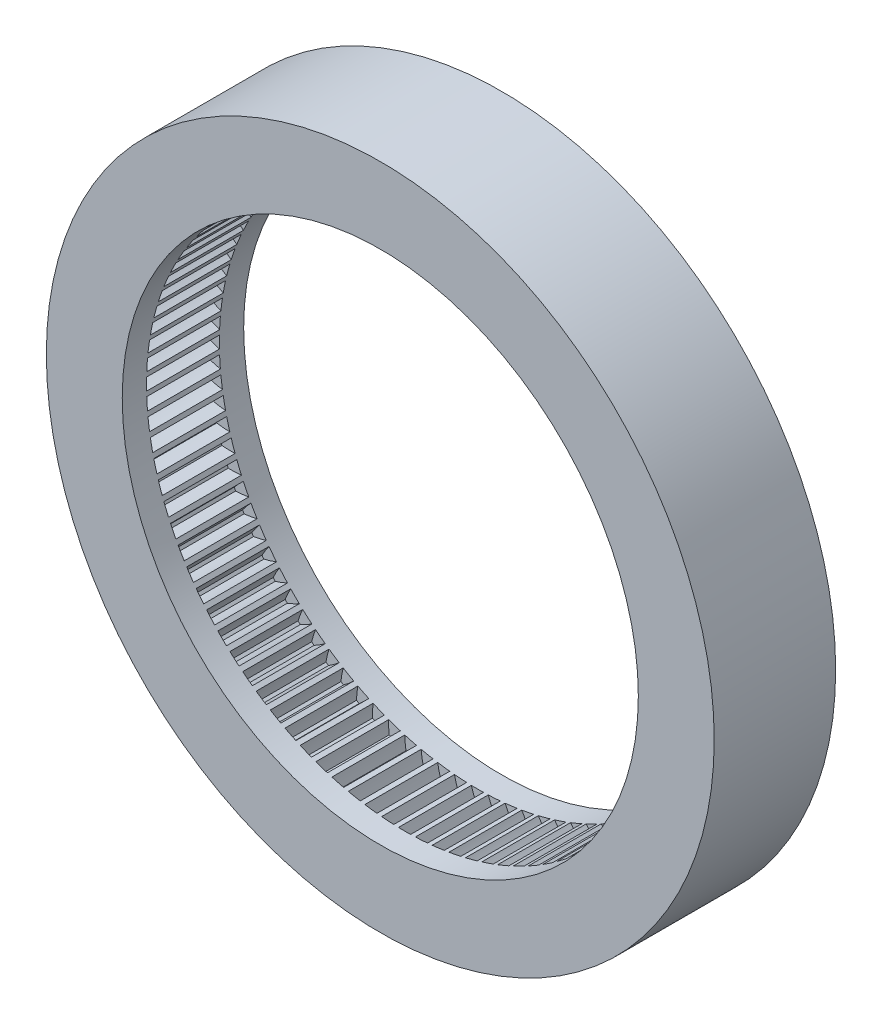
from build123d import *

# Parameters (mm, degrees)
GEAR_BASESKETCH_R                            = 27.5
GEAR_BASESKETCH_R_2                          = 21.250016654
F_0_45_MODULE_43_2000MM_P_D_DEPTH            = 5
TOOTH_CUT_START                              = -3
TOOTH_CUT_COARSE_PITCH_INVOLUTE_20_DEG_DEPTH = 6
TOOTH_PATTERN_96_96_COUNT                    = 96
ECHELLE1_SCALE                               = 2
ECHELLE2_SCALE                               = 0.25


with BuildPart() as part:
    # Gear-BaseSketch → 0.45 Module, 43.2000mm P.D. (new, symmetric)
    with BuildSketch(Plane.XY):
        Circle(GEAR_BASESKETCH_R)
        Circle(GEAR_BASESKETCH_R_2, mode=Mode.SUBTRACT)
    extrude(amount=F_0_45_MODULE_43_2000MM_P_D_DEPTH, both=True)

    # Tooth-Sketch; Backlash: 0.0000mm → Tooth-Cut, Coarse Pitch Involute 20 deg (cut)
    with BuildSketch(Plane.XY.offset(TOOTH_CUT_START)):
        with BuildLine():
            Line((0, 0), (0.500639061, 21.24411844))
            add(Edge.make_bspline(
                [(0.500639061, 21.24411844), (0.489561735, 21.283079872), (0.472130244, 21.342216966), (0.447446777, 21.421870139), (0.427559235, 21.483981899), (0.406530652, 21.54759804), (0.384331118, 21.612702477), (0.360930936, 21.679278701), (0.336300614, 21.747309775), (0.310410872, 21.816778338), (0.283232653, 21.887666612), (0.254737119, 21.959956396), (0.224895669, 22.033629078), (0.182817941, 22.134775688), (0.149829487, 22.211000568), (0.127132008, 22.262154449)],
                knots=[0, 0, 0, 0, 0.111968397, 0.17041778, 0.23051062, 0.292246917, 0.35562667, 0.42064988, 0.487316547, 0.55562667, 0.62558025, 0.697177287, 0.77041778, 0.84530173, 1, 1, 1, 1], degree=3))
            ThreePointArc((0.127132008, 22.262154449), (0, 22.262517451), (-0.127132008, 22.262154449))
            add(Edge.make_bspline(
                [(-0.500639061, 21.24411844), (-0.489561735, 21.283079872), (-0.472130244, 21.342216966), (-0.447446777, 21.421870139), (-0.427559235, 21.483981899), (-0.406530652, 21.54759804), (-0.384331118, 21.612702477), (-0.360930936, 21.679278701), (-0.336300614, 21.747309775), (-0.310410872, 21.816778338), (-0.283232653, 21.887666612), (-0.254737119, 21.959956396), (-0.224895669, 22.033629078), (-0.182817941, 22.134775688), (-0.149829487, 22.211000568), (-0.127132008, 22.262154449)],
                knots=[0, 0, 0, 0, 0.111968397, 0.17041778, 0.23051062, 0.292246917, 0.35562667, 0.42064988, 0.487316547, 0.55562667, 0.62558025, 0.697177287, 0.77041778, 0.84530173, 1, 1, 1, 1], degree=3))
            Line((-0.500639061, 21.24411844), (0, 0))
        make_face()
    tooth_cut_coarse_pitch_involute_20_deg = extrude(amount=TOOTH_CUT_COARSE_PITCH_INVOLUTE_20_DEG_DEPTH, mode=Mode.SUBTRACT)

    # Tooth Pattern, 96 / 96: Tooth-Cut, Coarse Pitch Involute 20 deg ×96 about axis
    tooth_pattern_96_96_axis = Axis((0, 0, -88.99), (0, 0, 1))
    for i in range(1, TOOTH_PATTERN_96_96_COUNT):
        add(tooth_cut_coarse_pitch_involute_20_deg.rotate(tooth_pattern_96_96_axis, i * 360 / TOOTH_PATTERN_96_96_COUNT), mode=Mode.SUBTRACT)


with BuildPart() as part_1:
    # Echelle1: scaled about (0, 0, 0)
    add(part.part.scale(ECHELLE1_SCALE))


with BuildPart() as part_2:
    # Echelle2: scaled about (1e-09, 0, 0)
    add(part_1.part.scale(ECHELLE2_SCALE).moved(Location((1e-09, 0, 0))))


solid = part_2.part
